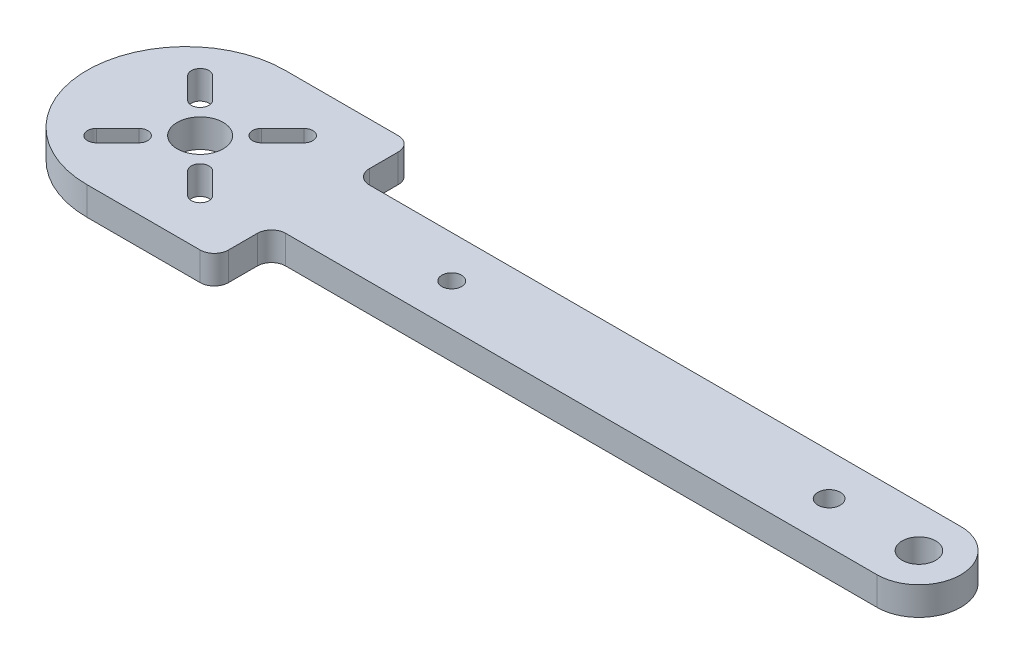
from build123d import *

# Parameters (mm, degrees)
SKETCH1_R           = 3.25
SKETCH1_R_2         = 2.38125
SKETCH1_R_3         = 1.397
BOSS_EXTRUDE1_DEPTH = 4
SKETCH2_R           = 1.5875
CUT_EXTRUDE1_DEPTH  = 10


with BuildPart() as part:
    # Sketch1 → Boss-Extrude1 (new body)
    with BuildSketch(Plane(origin=(0, 0, 0), x_dir=(1, 0, 0), z_dir=(0, 1, 0))):
        with BuildLine():
            Line((-50.8, 14), (-36.8, 14))
            ThreePointArc((-36.8, 14), (-35.385786438, 13.414213562), (-34.8, 12))
            Line((-34.8, 12), (-34.8, 7.914556152))
            ThreePointArc((-34.8, 7.914556152), (-34.214213562, 6.500342589), (-32.8, 5.914556152))
            Line((-32.8, 5.914556152), (50.8, 5.914556152))
            ThreePointArc((50.8, 5.914556152), (56.714556152, 0), (50.8, -5.914556152))
            Line((50.8, -5.914556152), (-32.8, -5.914556152))
            ThreePointArc((-32.8, -5.914556152), (-34.214213562, -6.500342589), (-34.8, -7.914556152))
            Line((-34.8, -7.914556152), (-34.8, -12))
            ThreePointArc((-34.8, -12), (-35.385786438, -13.414213562), (-36.8, -14))
            Line((-36.8, -14), (-50.8, -14))
            Line((-50.8, -14), (-52.8, -14))
            ThreePointArc((-52.8, -14), (-66.8, 0), (-52.8, 14))
            Line((-52.8, 14), (-50.8, 14))
        make_face()
        with Locations((-50.8, 0)):
            Circle(SKETCH1_R, mode=Mode.SUBTRACT)
        with Locations((50.8, 0)):
            Circle(SKETCH1_R_2, mode=Mode.SUBTRACT)
        with Locations((-15.24, 0)):
            Circle(SKETCH1_R_3, mode=Mode.SUBTRACT)
        with BuildLine():
            Line((-57.252349378, 8.220116331), (-54.247145558, 5.214912511))
            ThreePointArc((-54.247145558, 5.214912511), (-54.247145558, 3.447145558), (-56.014912511, 3.447145558))
            Line((-56.014912511, 3.447145558), (-59.020116331, 6.452349378))
            ThreePointArc((-59.020116331, 6.452349378), (-59.020116331, 8.220116331), (-57.252349378, 8.220116331))
        make_face(mode=Mode.SUBTRACT)
        with BuildLine():
            Line((-42.579883669, 6.452349378), (-45.585087489, 3.447145558))
            ThreePointArc((-45.585087489, 3.447145558), (-47.352854442, 3.447145558), (-47.352854442, 5.214912511))
            Line((-47.352854442, 5.214912511), (-44.347650622, 8.220116331))
            ThreePointArc((-44.347650622, 8.220116331), (-42.579883669, 8.220116331), (-42.579883669, 6.452349378))
        make_face(mode=Mode.SUBTRACT)
        with BuildLine():
            Line((-44.347650622, -8.220116331), (-47.352854442, -5.214912511))
            ThreePointArc((-47.352854442, -5.214912511), (-47.352854442, -3.447145558), (-45.585087489, -3.447145558))
            Line((-45.585087489, -3.447145558), (-42.579883669, -6.452349378))
            ThreePointArc((-42.579883669, -6.452349378), (-42.579883669, -8.220116331), (-44.347650622, -8.220116331))
        make_face(mode=Mode.SUBTRACT)
        with BuildLine():
            Line((-59.020116331, -6.452349378), (-56.014912511, -3.447145558))
            ThreePointArc((-56.014912511, -3.447145558), (-54.247145558, -3.447145558), (-54.247145558, -5.214912511))
            Line((-54.247145558, -5.214912511), (-57.252349378, -8.220116331))
            ThreePointArc((-57.252349378, -8.220116331), (-59.020116331, -8.220116331), (-59.020116331, -6.452349378))
        make_face(mode=Mode.SUBTRACT)
    extrude(amount=BOSS_EXTRUDE1_DEPTH)

    # Sketch2 → Cut-Extrude1 (cut)
    with BuildSketch(Plane.XZ):
        with Locations((38.1, 0)):
            Circle(SKETCH2_R)
    extrude(amount=-CUT_EXTRUDE1_DEPTH, mode=Mode.SUBTRACT)


solid = part.part
